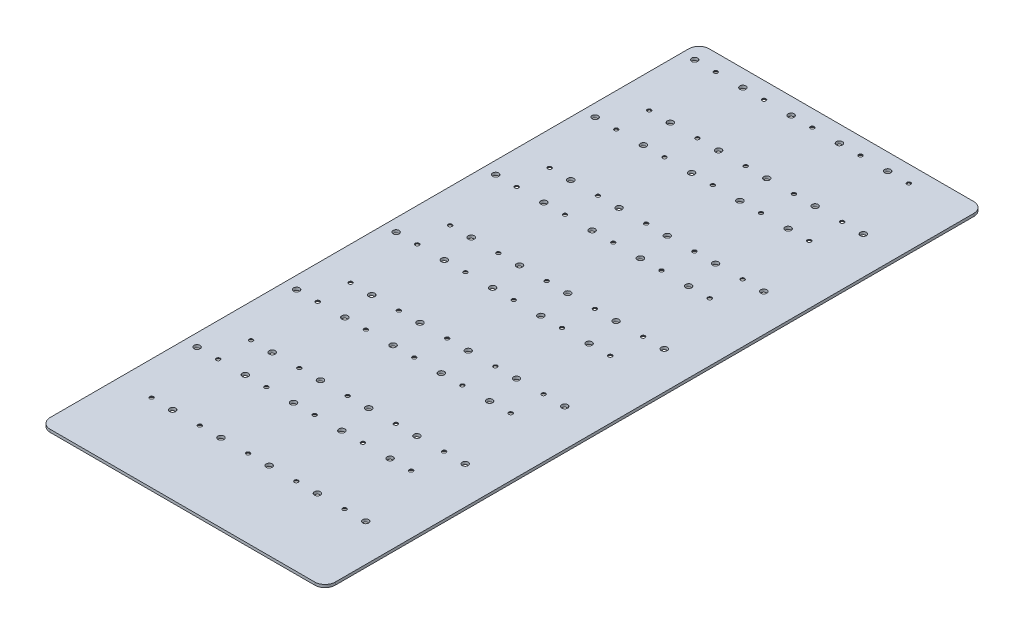
from build123d import *

# Parameters (mm, degrees)
SKETCH1_W                  = 236.3
SKETCH1_H                  = 546.3
BOSS_EXTRUDE1_DEPTH        = 2.286
SKETCH2_R                  = 2.5
SKETCH2_R_2                = 1.6
CUT_EXTRUDE1_DEPTH         = 298.616482736
CHAMFER1_SIZE              = 1.8
LPATTERN3_COUNT            = 6
LPATTERN3_PITCH            = 82.5
LPATTERN3_COUNT_DIR2       = 5
LPATTERN3_PITCH_DIR2       = 40
CHAMFER1_OF_LPATTERN3_SIZE = 1.8
FILLET1_R                  = 8.5


with BuildPart() as part:
    # Sketch1 → Boss-Extrude1 (new body)
    with BuildSketch(Plane(origin=(0, 0, 0), x_dir=(1, 0, 0), z_dir=(0, 1, 0))):
        Rectangle(SKETCH1_W, SKETCH1_H)
    extrude(amount=BOSS_EXTRUDE1_DEPTH)

    # Sketch2 → Cut-Extrude1 (cut, symmetric)
    with BuildSketch(Plane(origin=(0, 2.286, 0), x_dir=(1, 0, 0), z_dir=(0, 1, 0))):
        with Locations((-107.8251, 259.25)):
            Circle(SKETCH2_R)
        with Locations((-90.3251, 259.25)):
            Circle(SKETCH2_R_2)
        with Locations((-72.8251, 204.05)):
            Circle(SKETCH2_R)
        with Locations((-90.3251, 204.05)):
            Circle(SKETCH2_R_2)
    cut_extrude1 = extrude(amount=CUT_EXTRUDE1_DEPTH, both=True, mode=Mode.SUBTRACT)

    # Chamfer1
    chamfer1_edges = [part.edges().sort_by_distance(p)[0] for p in [
        (-91.9251, 0, -259.25),
        (-91.9251, 0, -204.05),
    ]]
    chamfer(chamfer1_edges, length=CHAMFER1_SIZE)

    # LPattern3: Cut-Extrude1 6 × 5
    with Locations(*[(j * LPATTERN3_PITCH_DIR2, 0, i * LPATTERN3_PITCH) for i in range(LPATTERN3_COUNT) for j in range(LPATTERN3_COUNT_DIR2) if (i, j) != (0, 0)]):
        add(cut_extrude1, mode=Mode.SUBTRACT)

    # Chamfer1 of LPattern3
    chamfer1_of_lpattern3_edges = [part.edges().sort_by_distance(p)[0] for p in [
        (-51.9251, 0, -259.25),
        (-51.9251, 0, -204.05),
        (-11.9251, 0, -259.25),
        (-11.9251, 0, -204.05),
        (28.0749, 0, -259.25),
        (28.0749, 0, -204.05),
        (68.0749, 0, -259.25),
        (68.0749, 0, -204.05),
        (-91.9251, 0, -176.75),
        (-91.9251, 0, -121.55),
        (-51.9251, 0, -176.75),
        (-51.9251, 0, -121.55),
        (-11.9251, 0, -176.75),
        (-11.9251, 0, -121.55),
        (28.0749, 0, -176.75),
        (28.0749, 0, -121.55),
        (68.0749, 0, -176.75),
        (68.0749, 0, -121.55),
        (-91.9251, 0, -94.25),
        (-91.9251, 0, -39.05),
        (-51.9251, 0, -94.25),
        (-51.9251, 0, -39.05),
        (-11.9251, 0, -94.25),
        (-11.9251, 0, -39.05),
        (28.0749, 0, -94.25),
        (28.0749, 0, -39.05),
        (68.0749, 0, -94.25),
        (68.0749, 0, -39.05),
        (-91.9251, 0, -11.75),
        (-91.9251, 0, 43.45),
        (-51.9251, 0, -11.75),
        (-51.9251, 0, 43.45),
        (-11.9251, 0, -11.75),
        (-11.9251, 0, 43.45),
        (28.0749, 0, -11.75),
        (28.0749, 0, 43.45),
        (68.0749, 0, -11.75),
        (68.0749, 0, 43.45),
        (-91.9251, 0, 70.75),
        (-91.9251, 0, 125.95),
        (-51.9251, 0, 70.75),
        (-51.9251, 0, 125.95),
        (-11.9251, 0, 70.75),
        (-11.9251, 0, 125.95),
        (28.0749, 0, 70.75),
        (28.0749, 0, 125.95),
        (68.0749, 0, 70.75),
        (68.0749, 0, 125.95),
        (-91.9251, 0, 153.25),
        (-91.9251, 0, 208.45),
        (-51.9251, 0, 153.25),
        (-51.9251, 0, 208.45),
        (-11.9251, 0, 153.25),
        (-11.9251, 0, 208.45),
        (28.0749, 0, 153.25),
        (28.0749, 0, 208.45),
        (68.0749, 0, 153.25),
        (68.0749, 0, 208.45),
    ]]
    chamfer(chamfer1_of_lpattern3_edges, length=CHAMFER1_OF_LPATTERN3_SIZE)

    # Fillet1
    fillet1_edges = [part.edges().sort_by_distance(p)[0] for p in [
        (118.15, 1.143, -273.15),
        (-118.15, 1.143, 273.15),
        (118.15, 1.143, 273.15),
        (-118.15, 1.143, -273.15),
    ]]
    fillet(fillet1_edges, radius=FILLET1_R)


solid = part.part
